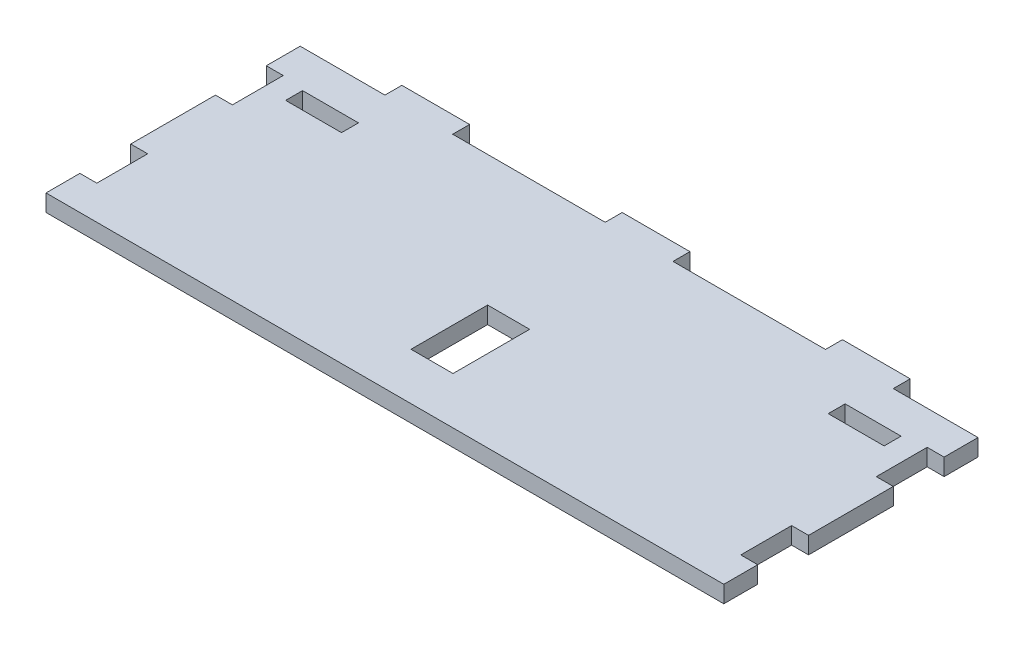
from build123d import *

# Parameters (mm, degrees)
SKETCH1_W           = 16.5
SKETCH1_H           = 5
BOSS_EXTRUDE1_DEPTH = 5
SKETCH1_3_W         = 12.4
SKETCH1_3_H         = 22.6
CUT_EXTRUDE3_DEPTH  = 109.771549589


with BuildPart() as part:
    # Sketch1 → Boss-Extrude1 (new body)
    with BuildSketch(Plane(origin=(0, 0, 0), x_dir=(1, 0, 0), z_dir=(0, 1, 0))):
        Polygon((-75, 37.5), (-100, 37.5), (-100, 27.5), (-95, 27.5), (-95, 12.5), (-100, 12.5), (-100, -12.5), (-95, -12.5), (-95, -27.5), (-100, -27.5), (-100, -37.5), (100, -37.5), (100, -27.5), (95, -27.5), (95, -12.5), (100, -12.5), (100, 12.5), (95, 12.5), (95, 27.5), (100, 27.5), (100, 37.5), (75, 37.5), (75, 42.5), (55, 42.5), (55, 37.5), (10, 37.5), (10, 42.5), (-10, 42.5), (-10, 37.5), (-55, 37.5), (-55, 42.5), (-75, 42.5), align=None)
        with Locations((-80.05, 24)):
            Rectangle(SKETCH1_W, SKETCH1_H, mode=Mode.SUBTRACT)
        with Locations((80.05, 24)):
            Rectangle(SKETCH1_W, SKETCH1_H, mode=Mode.SUBTRACT)
    extrude(amount=BOSS_EXTRUDE1_DEPTH)

    # Sketch1<3> → Cut-Extrude3 (cut, through all)
    with BuildSketch(Plane(origin=(0, 0, 0), x_dir=(1, 0, 0), z_dir=(0, 1, 0))):
        with Locations((0, -12.3)):
            Rectangle(SKETCH1_3_W, SKETCH1_3_H)
    extrude(amount=CUT_EXTRUDE3_DEPTH, mode=Mode.SUBTRACT)


solid = part.part
